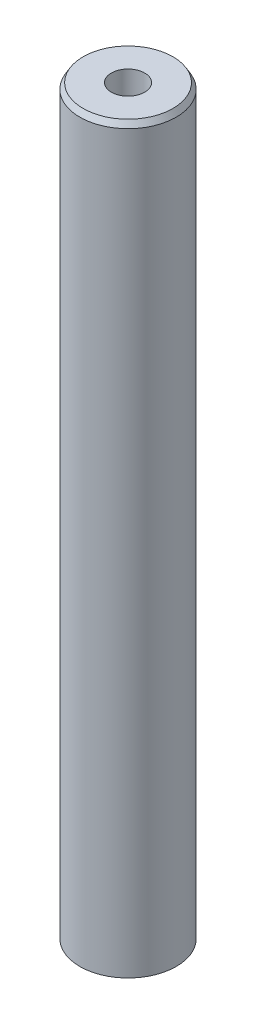
from build123d import *
from OCP.BRepFilletAPI import BRepFilletAPI_MakeChamfer

# Parameters (mm, degrees)
SKETCH1_R           = 15
BOSS_EXTRUDE1_DEPTH = 231.619543128
SKETCH2_R           = 5.181058045
CUT_EXTRUDE1_DEPTH  = 233.58893516
CHAMFER1_SIZE       = 1.811159425
CHAMFER1_SIZE2      = 1.045673381


with BuildPart() as part:
    # Sketch1 → Boss-Extrude1 (new body)
    with BuildSketch(Plane(origin=(0, 0, 0), x_dir=(1, 0, 0), z_dir=(0, 1, 0))):
        Circle(SKETCH1_R)
    extrude(amount=BOSS_EXTRUDE1_DEPTH)

    # Sketch2 → Cut-Extrude1 (cut, through all)
    with BuildSketch(Plane(origin=(0, 0, 0), x_dir=(1, 0, 0), z_dir=(0, 1, 0))):
        Circle(SKETCH2_R)
    extrude(amount=CUT_EXTRUDE1_DEPTH, mode=Mode.SUBTRACT)

    # Chamfer1: one chamfer whose edges measure the first distance from different faces: ONE call of the kernel's chamfer builder (chamfer() names one face for all edges)
    chamfer1_edges_1 = [part.edges().sort_by_distance(p)[0] for p in [
        (-15, 231.619543128, 0),
    ]]
    chamfer1_side_1 = [part.faces().sort_by_distance(p)[0] for p in [
        (-15, 115.809771564, 0),
    ]]
    chamfer1_edges_2 = [part.edges().sort_by_distance(p)[0] for p in [
        (-15, 0, 0),
    ]]
    chamfer1_side_2 = [part.faces().sort_by_distance(p)[0] for p in [
        (-14.575735931, 0, 0),
    ]]
    chamfer1 = BRepFilletAPI_MakeChamfer(part.part.solid().wrapped)
    for e in chamfer1_edges_1:
        chamfer1.Add(CHAMFER1_SIZE, CHAMFER1_SIZE2, e.wrapped, chamfer1_side_1[0].wrapped)  # the first distance lies on this face
    for e in chamfer1_edges_2:
        chamfer1.Add(CHAMFER1_SIZE, CHAMFER1_SIZE2, e.wrapped, chamfer1_side_2[0].wrapped)  # the first distance lies on this face
    add(Compound.cast(chamfer1.Shape()), mode=Mode.REPLACE)


solid = part.part
